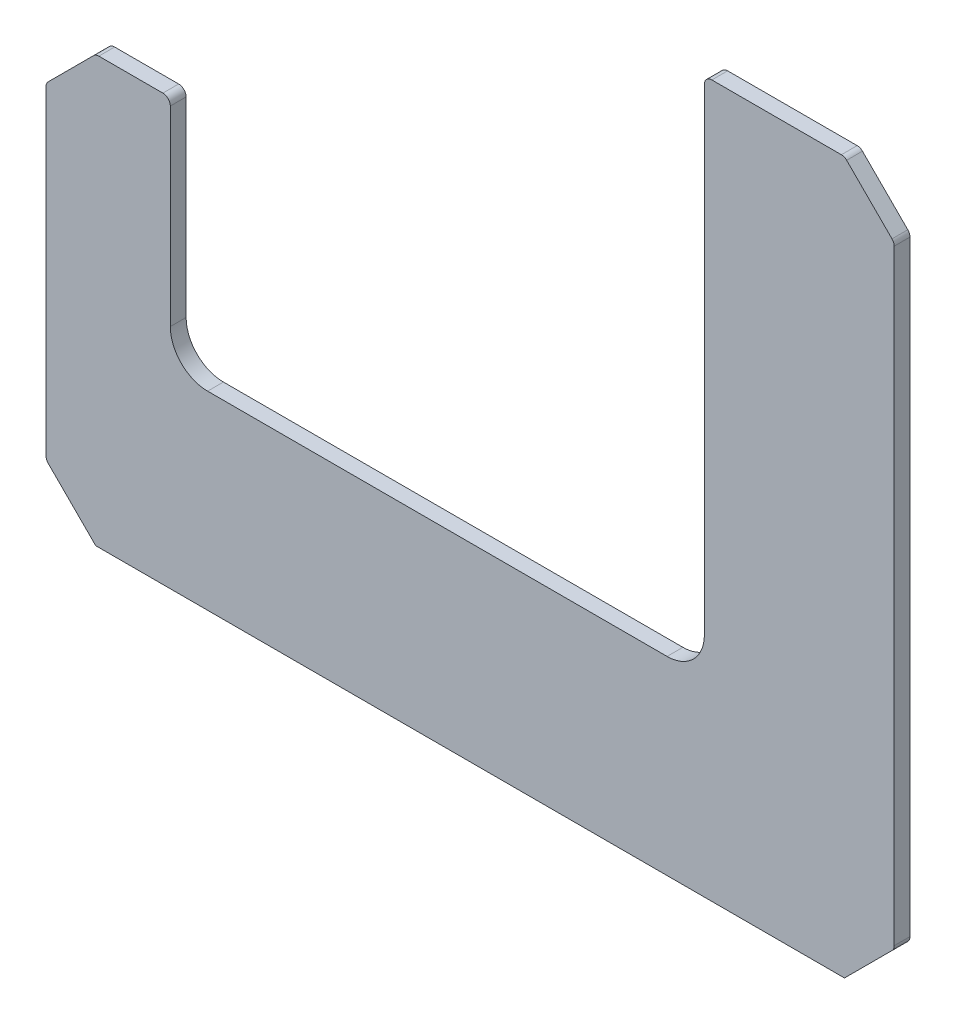
from build123d import *

# Parameters (mm, degrees)
BOSS_EXTRUDE1_DEPTH      = 3.175
BOSS_EXTRUDE1_DEPTH_BACK = 3.175
CHAMFER1_SIZE            = 20
FILLET1_R                = 15
FILLET2_R                = 3


with BuildPart() as part:
    # Sketch2 → Boss-Extrude1 (new, two sides: drawn at the far end of the back side and taken through both)
    with BuildSketch(Plane.XY.offset(-BOSS_EXTRUDE1_DEPTH_BACK)):
        Polygon((-157.4125, 94.825), (-107.4125, 94.825), (-107.4125, 0), (107.4125, 0), (107.4125, 209.825), (183.7625, 209.825), (183.7625, -76.35), (58.275, -76.35), (-31.925, -76.35), (-157.4125, -76.35), align=None)
    extrude(amount=BOSS_EXTRUDE1_DEPTH + BOSS_EXTRUDE1_DEPTH_BACK)

    # Chamfer1
    chamfer1_edges = [part.edges().sort_by_distance(p)[0] for p in [
        (-157.4125, -76.35, 0),
        (183.7625, -76.35, 0),
        (183.7625, 209.825, 0),
        (-157.4125, 94.825, 0),
    ]]
    chamfer(chamfer1_edges, length=CHAMFER1_SIZE)

    # Fillet1
    fillet1_edges = [part.edges().sort_by_distance(p)[0] for p in [
        (107.4125, 0, 0),
        (-107.4125, 0, 0),
    ]]
    fillet(fillet1_edges, radius=FILLET1_R)

    # Fillet2
    fillet2_edges = [part.edges().sort_by_distance(p)[0] for p in [
        (183.7625, -56.35, 0),
        (-157.4125, -56.35, 0),
        (-157.4125, 74.825, 0),
        (-137.4125, 94.825, 0),
        (-107.4125, 94.825, 0),
        (183.7625, 189.825, 0),
        (163.7625, 209.825, 0),
        (107.4125, 209.825, 0),
    ]]
    fillet(fillet2_edges, radius=FILLET2_R)


solid = part.part
